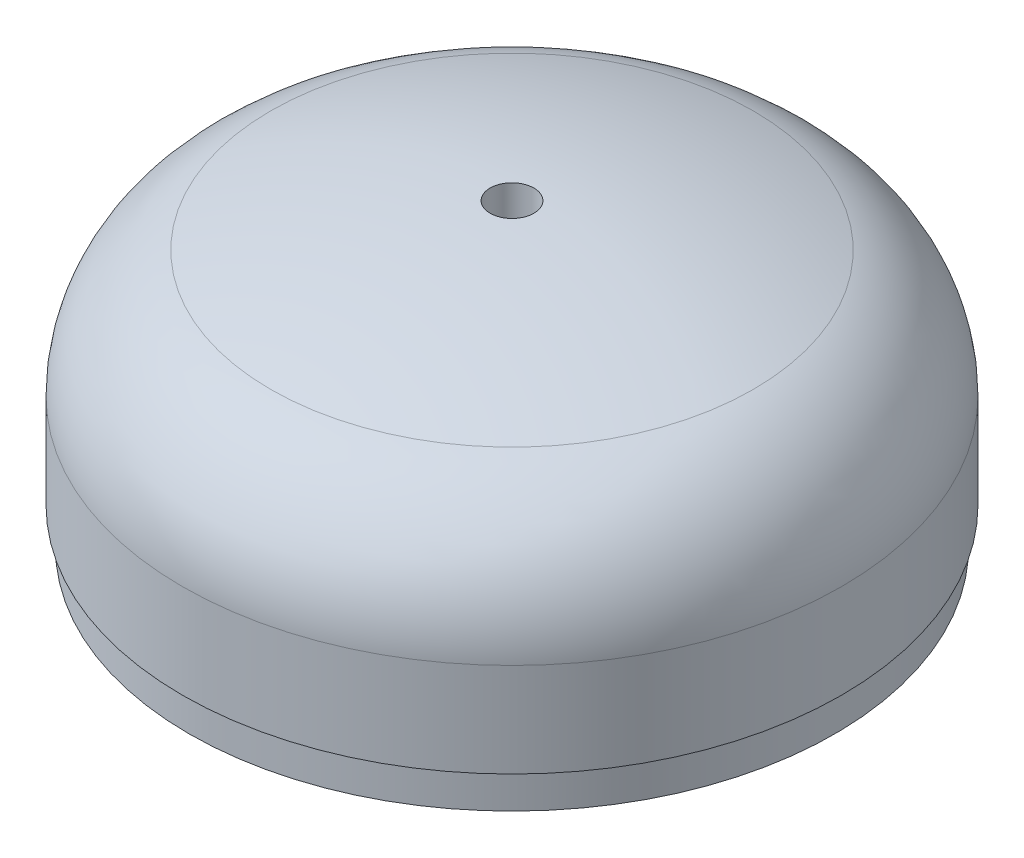
from build123d import *


with BuildPart() as part:
    # Sketch1 → Revolve2 (revolve)
    with BuildSketch(Plane.XY):
        with BuildLine():
            Line((-63.5, 25.209576395), (-63.5, 7.0880256))
            Line((-63.5, 7.0880256), (-62.221702163, 6.35))
            Line((-62.221702163, 6.35), (-62.221702163, 0))
            Line((-62.221702163, 0), (-59.840452163, 0))
            Line((-59.840452163, 0), (-59.840452163, 6.35))
            Line((-59.840452163, 6.35), (-56.515, 25.209576395))
            ThreePointArc((-56.515, 25.209576395), (-53.099113577, 36.09429011), (-44.076470588, 43.075492455))
            ThreePointArc((-44.076470588, 43.075492455), (-24.461267699, 48.591399426), (-4.2164, 50.899373851))
            Line((-4.2164, 50.899373851), (-4.2164, 57.8880256))
            ThreePointArc((-4.2164, 57.8880256), (-25.692788323, 55.467905735), (-46.500676471, 49.626328344))
            ThreePointArc((-46.500676471, 49.626328344), (-58.831621889, 40.085351805), (-63.5, 25.209576395))
        make_face()
    revolve(axis=Axis((0, 127.060987048, 0), (0, -1, 0)))


solid = part.part
